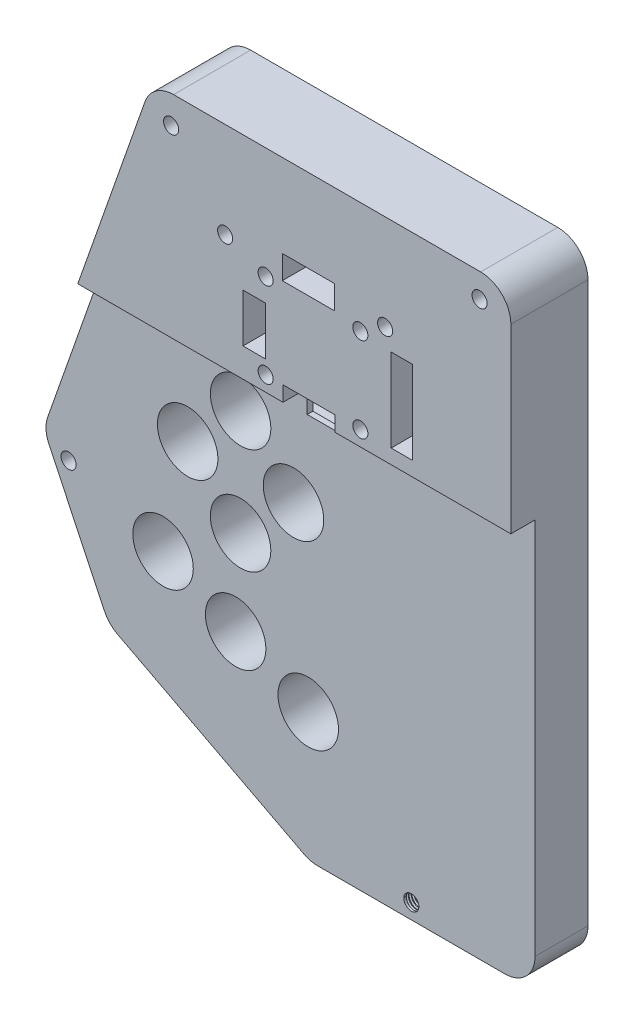
from build123d import *

# Parameters (mm, degrees)
BOSS_EXTRUDE1_DEPTH       = 8.89
CUT_EXTRUDE6_DEPTH        = 112.74556725
CUT_EXTRUDE6_DEPTH_BACK   = 112.74556725
SKETCH9_R                 = 1.267511842
SKETCH9_W                 = 3.81
SKETCH9_H                 = 8.128
SKETCH9_W_2               = 3.556
SKETCH9_H_2               = 13.97
SKETCH9_W_3               = 8.73125
SKETCH9_H_3               = 3.96875
CUT_EXTRUDE7_DEPTH        = 7.9375
CUT_EXTRUDE7_DEPTH_BACK   = 112.74556725
SKETCH4_W                 = 34.29
SKETCH4_H                 = 30.48
CUT_EXTRUDE8_DEPTH        = 112.74556725
CUT_EXTRUDE8_DEPTH_BACK   = 112.74556725
SKETCH3_R                 = 5.08
BOSS_EXTRUDE2_OUTLINE_R   = 1.267511842
BOSS_EXTRUDE2_OUTLINE_W   = 3.81
BOSS_EXTRUDE2_OUTLINE_H   = 8.128
BOSS_EXTRUDE2_OUTLINE_W_2 = 3.556
BOSS_EXTRUDE2_OUTLINE_H_2 = 13.97
BOSS_EXTRUDE2_OUTLINE_W_3 = 8.73125
BOSS_EXTRUDE2_OUTLINE_H_3 = 3.96875
BOSS_EXTRUDE2_DEPTH       = 4.064
CUT_EXTRUDE9_DEPTH        = 113.142078704
CUT_EXTRUDE9_DEPTH_BACK   = 113.142078704
SKETCH12_R                = 1.27
CUT_EXTRUDE10_DEPTH       = 112.74556725
CUT_EXTRUDE10_DEPTH_BACK  = 6.35
SKETCH14_R                = 1.27
THREAD1_PITCH             = 0.453571429


# Read off the part's stored shape, not the designer's step: Boss-Extrude2
with BuildPart() as part:
    # Sketch1 → Boss-Extrude1 (new body)
    with BuildSketch(Plane.XY):
        with BuildLine():
            Line((-3.314058103, 6.35), (48.26, 6.35))
            ThreePointArc((48.26, 6.35), (51.852102448, 4.862102448), (53.34, 1.27))
            Line((53.34, 1.27), (53.34, -92.71))
            ThreePointArc((53.34, -92.71), (51.852102448, -96.302102448), (48.26, -97.79))
            Line((48.26, -97.79), (16.846989059, -97.79))
            ThreePointArc((16.846989059, -97.79), (15.638688158, -97.644208035), (14.499741809, -97.215200367))
            Line((14.499741809, -97.215200367), (-16.7505185, -80.933552139))
            ThreePointArc((-16.7505185, -80.933552139), (-18.059258376, -79.955412607), (-18.989802686, -78.61241436))
            Line((-18.989802686, -78.61241436), (-28.309569459, -59.040904135))
            ThreePointArc((-28.309569459, -59.040904135), (-28.795802898, -57.127870198), (-28.51617555, -55.173917704))
            Line((-28.51617555, -55.173917704), (-8.107195629, 2.952923842))
            ThreePointArc((-8.107195629, 2.952923842), (-6.251501454, 5.414614163), (-3.314058103, 6.35))
        make_face()
    extrude(amount=BOSS_EXTRUDE1_DEPTH)

    # Sketch9 → Cut-Extrude6 (cut, two sides: drawn at the far end of the back side and taken through both)
    with BuildSketch(Plane(origin=(0, 0, 0), x_dir=(-1, 0, 0), z_dir=(0, 0, -1)).offset(-CUT_EXTRUDE6_DEPTH_BACK)):
        with Locations((-5.348417946, -30.953529248)):
            Circle(SKETCH9_R)
        with Locations((-32.218986844, -9.676052932)):
            Circle(SKETCH9_R)
        with Locations((-12.150498686, -12.37729109)):
            Circle(SKETCH9_R)
        with Locations((-12.150498686, -26.66479109)):
            Circle(SKETCH9_R)
        with Locations((-28.057248686, -12.37729109)):
            Circle(SKETCH9_R)
        with Locations((-5.348417946, -9.676052932)):
            Circle(SKETCH9_R)
        with Locations((-32.218986844, -30.953529248)):
            Circle(SKETCH9_R)
        with Locations((-28.057248686, -26.66479109)):
            Circle(SKETCH9_R)
        with Locations((-10.245904396, -20.31479109)):
            Rectangle(SKETCH9_W, SKETCH9_H)
        Polygon((-15.064842187, -33.01479109), (-23.802748686, -33.01479109), (-23.802748686, -26.66479109), (-20.913498686, -26.66479109), (-15.064842187, -26.66479109), align=None)
        with Locations((-35.010498686, -19.798068783)):
            Rectangle(SKETCH9_W_2, SKETCH9_H_2)
        with Locations((-19.310123686, -9.59916609)):
            Rectangle(SKETCH9_W_3, SKETCH9_H_3)
    extrude(amount=CUT_EXTRUDE6_DEPTH + CUT_EXTRUDE6_DEPTH_BACK, mode=Mode.SUBTRACT)

    # Sketch4 → Cut-Extrude7 (cut, two sides: drawn at the far end of the back side and taken through both)
    with BuildSketch(Plane.XY.offset(-CUT_EXTRUDE7_DEPTH_BACK)):
        with Locations((20.024498686, -18.415)):
            Rectangle(SKETCH4_W, SKETCH4_H)
    extrude(amount=CUT_EXTRUDE7_DEPTH + CUT_EXTRUDE7_DEPTH_BACK, mode=Mode.SUBTRACT)

    # Sketch3 → Cut-Extrude8 (cut, two sides: drawn at the far end of the back side and taken through both)
    with BuildSketch(Plane.XY.offset(8.89).offset(-CUT_EXTRUDE8_DEPTH_BACK)):
        with Locations(Location((3.878385852, -38.1, 0), (0, 0, 61.044975628))):
            Circle(SKETCH3_R)
        with Locations((-5.011614148, -46.99)):
            Circle(SKETCH3_R)
        with Locations((3.878385852, -55.88)):
            Circle(SKETCH3_R)
        with Locations((12.768385852, -46.99)):
            Circle(SKETCH3_R)
        with Locations((-9.144, -65.024)):
            Circle(SKETCH3_R)
        with Locations((3.048, -70.612)):
            Circle(SKETCH3_R)
        with Locations((15.24, -76.2)):
            Circle(SKETCH3_R)
    extrude(amount=CUT_EXTRUDE8_DEPTH + CUT_EXTRUDE8_DEPTH_BACK, mode=Mode.SUBTRACT)

    # Boss-Extrude2 outline → Boss-Extrude2 (add)
    with BuildSketch(Plane.XY.offset(8.89)):
        with BuildLine():
            Line((15.064842187, -29.21), (15.064842187, -26.66479109))
            Line((15.064842187, -26.66479109), (23.802748686, -26.66479109))
            Line((23.802748686, -26.66479109), (23.802748686, -29.21))
            Line((23.802748686, -29.21), (53.34, -29.21))
            Line((53.34, -29.21), (53.34, 1.27))
            ThreePointArc((53.34, 1.27), (51.852102448, 4.862102448), (48.26, 6.35))
            Line((48.26, 6.35), (-3.314058103, 6.35))
            ThreePointArc((-3.314058103, 6.35), (-6.251501454, 5.414614163), (-8.107195629, 2.952923842))
            Line((-8.107195629, 2.952923842), (-19.399955556, -29.21))
            Line((-19.399955556, -29.21), (15.064842187, -29.21))
        make_face()
        with Locations((12.150498686, -26.66479109)):
            Circle(BOSS_EXTRUDE2_OUTLINE_R, mode=Mode.SUBTRACT)
        with Locations((10.245904396, -20.31479109)):
            Rectangle(BOSS_EXTRUDE2_OUTLINE_W, BOSS_EXTRUDE2_OUTLINE_H, mode=Mode.SUBTRACT)
        with Locations((12.150498686, -12.37729109)):
            Circle(BOSS_EXTRUDE2_OUTLINE_R, mode=Mode.SUBTRACT)
        with Locations((28.057248686, -26.66479109)):
            Circle(BOSS_EXTRUDE2_OUTLINE_R, mode=Mode.SUBTRACT)
        with Locations((35.010498686, -19.798068783)):
            Rectangle(BOSS_EXTRUDE2_OUTLINE_W_2, BOSS_EXTRUDE2_OUTLINE_H_2, mode=Mode.SUBTRACT)
        with Locations((28.057248686, -12.37729109)):
            Circle(BOSS_EXTRUDE2_OUTLINE_R, mode=Mode.SUBTRACT)
        with Locations((5.348417946, -9.676052932)):
            Circle(BOSS_EXTRUDE2_OUTLINE_R, mode=Mode.SUBTRACT)
        with Locations((19.310123686, -9.59916609)):
            Rectangle(BOSS_EXTRUDE2_OUTLINE_W_3, BOSS_EXTRUDE2_OUTLINE_H_3, mode=Mode.SUBTRACT)
        with Locations((32.218986844, -9.676052932)):
            Circle(BOSS_EXTRUDE2_OUTLINE_R, mode=Mode.SUBTRACT)
    extrude(amount=BOSS_EXTRUDE2_DEPTH)

    # Sketch12 → Cut-Extrude9 (cut, two sides: drawn at the far end of the back side and taken through both)
    with BuildSketch(Plane(origin=(0, 0, 0), x_dir=(-1, 0, 0), z_dir=(0, 0, -1)).offset(-CUT_EXTRUDE9_DEPTH_BACK)):
        with Locations((-48.0822, 2.286)):
            Circle(SKETCH12_R)
        with Locations((3.718687848, 1.651)):
            Circle(SKETCH12_R)
        with Locations((25.012261453, -59.761967182)):
            Circle(SKETCH12_R)
    extrude(amount=CUT_EXTRUDE9_DEPTH + CUT_EXTRUDE9_DEPTH_BACK, mode=Mode.SUBTRACT)

    # Sketch14 → Cut-Extrude10 (cut, two sides: drawn at the far end of the back side and taken through both)
    with BuildSketch(Plane.XY.offset(8.89).offset(-CUT_EXTRUDE10_DEPTH_BACK)):
        with Locations(Location((32.55349453, -95.25, 0), (0, 0, 180))):
            Circle(SKETCH14_R)
    extrude(amount=CUT_EXTRUDE10_DEPTH + CUT_EXTRUDE10_DEPTH_BACK, mode=Mode.SUBTRACT)

    # Thread1: the profile of Thread Profile1 profile screwed along a right-hand helix of 14 turns, 6 arcs to a turn; built about Z, then put on its axis
    thread1_z = Axis((0, 0, 0), (0, 0, 1))
    thread1_corners = [(1.2697, 0, -0.000173205), (1.515502736, 0, 0.141741071), (1.515502736, 0, 0.198437499), (1.2697, 0, 0.340351775)]
    with BuildLine(mode=Mode.PRIVATE) as thread1_profile:
        Line(thread1_corners[0], thread1_corners[1])
        Line(thread1_corners[1], thread1_corners[2])
        Line(thread1_corners[2], thread1_corners[3])
        Line(thread1_corners[3], thread1_corners[0])
    thread1_cap = Face(thread1_profile.wire())
    thread1_turn_angles = [0, 30, 60, 90, 120, 150, 180, 210, 240, 270, 300, 330, 360]
    thread1_turn_weights = [1, 0.8660254037844387, 1, 0.8660254037844387, 1, 0.8660254037844387, 1, 0.8660254037844387, 1, 0.8660254037844387, 1, 0.8660254037844387, 1]
    thread1_turn_rails = [Edge.make_bspline([Vector(p[0], p[1], 0).rotate(thread1_z, thread1_turn_angles[k]) / thread1_turn_weights[k] + Vector(0, 0, p[2] + THREAD1_PITCH * thread1_turn_angles[k] / 360) for k in range(13)], [0, 0, 0, 1, 1, 2, 2, 3, 3, 4, 4, 5, 5, 6, 6, 6], 2, thread1_turn_weights) for p in thread1_corners]
    thread1_turn_sides = [Face.make_surface_from_curves(thread1_turn_rails[p[0]], thread1_turn_rails[p[1]]) for p in [(0, 1), (1, 2), (2, 3), (3, 0)]]
    thread1 = Plane(origin=(32.55349453, -95.25, 8.89), x_dir=(-1, 0, 0), z_dir=(0, 0, -1)) * Solid(Shell([*[p.moved(Location((0, 0, THREAD1_PITCH * i))) for i in range(14) for p in thread1_turn_sides], thread1_cap, thread1_cap.rotate(thread1_z, 5040).moved(Location((0, 0, THREAD1_PITCH * 5040 / 360)))]))
    add(thread1, mode=Mode.SUBTRACT)


solid = part.part
